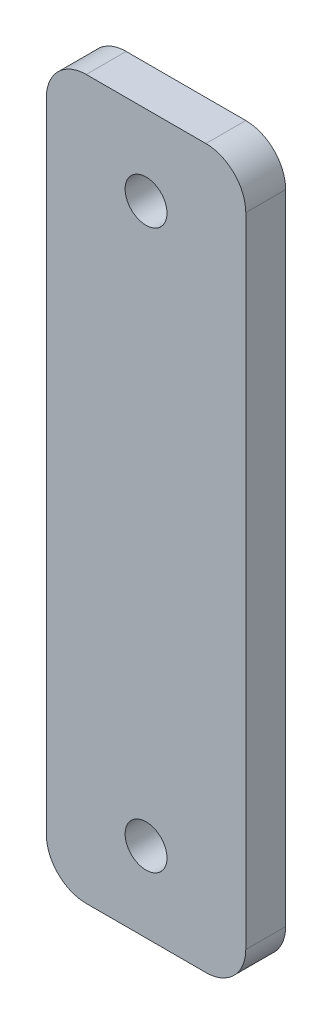
from build123d import *

# Parameters (mm, degrees)
IZIM1_W               = 50
IZIM1_H               = 180
TABAN_FLAN_1_DEPTH    = 10
RADYUS1_R             = 10
IZIM2_R               = 5.25
KES_EKSTR_ZYON1_DEPTH = 20


# Sheet-metal steps are written as plain solids
with BuildPart() as part:
    # Çizim1 → Taban-Flanş1 (new body)
    with BuildSketch(Plane.XY):
        Rectangle(IZIM1_W, IZIM1_H)
    extrude(amount=-TABAN_FLAN_1_DEPTH)

    # Radyus1
    radyus1_edges = [part.edges().sort_by_distance(p)[0] for p in [
        (25, -90, -5),
        (-25, -90, -5),
        (-25, 90, -5),
        (25, 90, -5),
    ]]
    fillet(radyus1_edges, radius=RADYUS1_R)

    # Çizim2 → Kes-Ekstrüzyon1 (cut)
    with BuildSketch(Plane.XY):
        with Locations((0, 70)):
            Circle(IZIM2_R)
        with Locations((0, -70)):
            Circle(IZIM2_R)
    extrude(amount=-KES_EKSTR_ZYON1_DEPTH, mode=Mode.SUBTRACT)


solid = part.part
